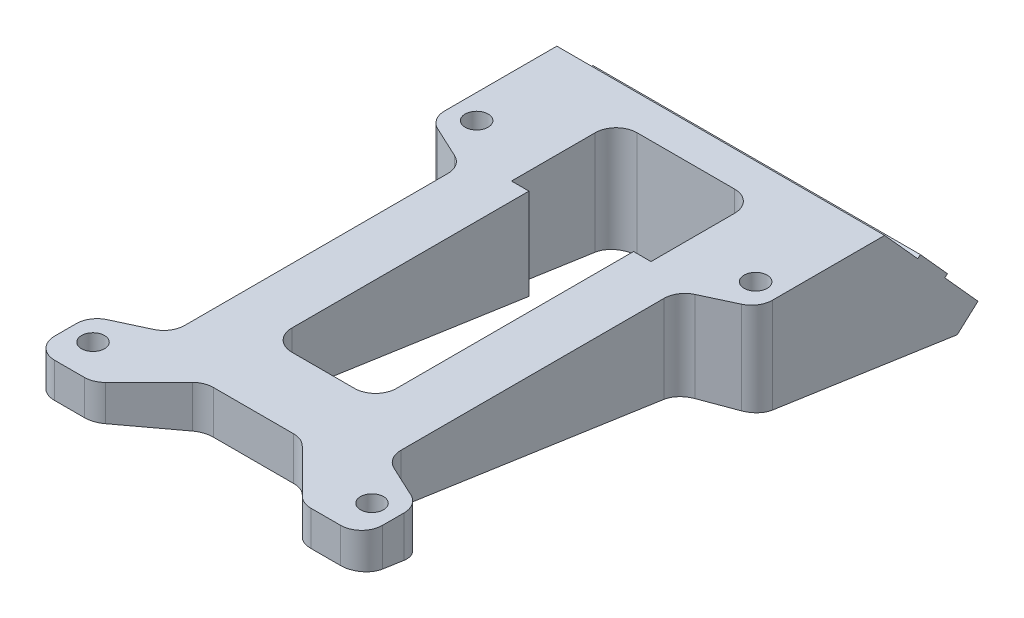
from build123d import *

# Parameters (mm, degrees)
EXTRUDE_2_DEPTH     = 5
SKETCH_3_R          = 1.65
CUT_EXTRUDE_1_DEPTH = 79.754364958
EXTRUDE_3_DEPTH     = 23.5
SKETCH_6_R          = 2.6
CUT_EXTRUDE_3_DEPTH = 83.719354566
CUT_EXTRUDE_4_REACH = 89.719
CUT_EXTRUDE_START   = -5
SKETCH_7_R          = 4.5
CUT_EXTRUDE_5_REACH = 85.529
CUT_EXTRUDE_START_2 = 3
SKETCH_8_R          = 3
CUT_EXTRUDE_2_DEPTH = 81.528760183
FILLET_1_R          = 3


with BuildPart() as part:
    # 草图2 → 凸台-拉伸2 (new body)
    with BuildSketch(Plane(origin=(0, 0, 0), x_dir=(1, 0, 0), z_dir=(0, 1, 0))):
        Polygon((0, 0), (23.5, 0), (23.5, -14), (23.5, -75), (0, -75), align=None)
    extrude_2 = extrude(amount=EXTRUDE_2_DEPTH)

    # 镜向1: 凸台-拉伸2 across plane
    add(extrude_2.mirror(Plane(origin=(0, 5, 75), x_dir=(0, 0, 1), z_dir=(1, 0, 0))))

    # 草图3 → 切除-拉伸1 (cut, through all)
    with BuildSketch(Plane(origin=(0, 5, 0), x_dir=(1, 0, 0), z_dir=(0, 1, 0))):
        with Locations(Location((-20, -15, 0), (0, 0, 270))):
            Circle(SKETCH_3_R)
        with Locations(Location((20, -15, 0), (0, 0, 270))):
            Circle(SKETCH_3_R)
        with Locations(Location((-20, -70, 0), (0, 0, 270))):
            Circle(SKETCH_3_R)
        with Locations(Location((20, -70, 0), (0, 0, 270))):
            Circle(SKETCH_3_R)
    extrude(amount=-CUT_EXTRUDE_1_DEPTH, mode=Mode.SUBTRACT)

    # 草图5 → 凸台-拉伸3 (add, symmetric)
    with BuildSketch(Plane(origin=(0, 0, 0), x_dir=(0, 0, -1), z_dir=(1, 0, 0))):
        Polygon((-75, 0), (10.410032825, -12.539418935), (13.382612127, -9.86289651), (0, 5), (0, 0), align=None)
        Polygon((4.750827305, -0.276328261), (8.631784822, -4.586568249), (9.003357235, -4.252002945), (5.122399718, 0.058237042), align=None)
    extrude(amount=EXTRUDE_3_DEPTH, both=True)

    # 草图6 → 切除-拉伸3 (cut, through all)
    with BuildSketch(Plane(origin=(0, 2.573244145, -2.857877151), x_dir=(1, 0, 0), z_dir=(0, 0.6691306063588544, -0.7431448254773979))):
        with Locations(Location((-13.5, 6.284275873, 0), (0, 0, 270))):
            Circle(SKETCH_6_R)
        with Locations(Location((13.5, 6.284275873, 0), (0, 0, 270))):
            Circle(SKETCH_6_R)
    extrude(amount=-CUT_EXTRUDE_3_DEPTH, mode=Mode.SUBTRACT)

    # 切除-拉伸4: up to this plane
    cut_extrude_4_end = Plane(origin=(23.5, -10.778746663, 1.582474746), z_dir=(0, 0.9893939239349117, -0.145257231423012))
    # 草图7 → 切除-拉伸4 (cut, up to the surface)
    with BuildSketch(Plane(origin=(0, 2.573244145, -2.857877151), x_dir=(1, 0, 0), z_dir=(0, 0.6691306063588544, -0.7431448254773979)).offset(CUT_EXTRUDE_START), mode=Mode.PRIVATE) as cut_extrude_4_sk1:
        with Locations(Location((-13.5, 6.284275873, 0), (0, 0, 270))):
            Circle(SKETCH_7_R)
    cut_extrude_4_tool1 = split(extrude(cut_extrude_4_sk1.sketch, amount=-CUT_EXTRUDE_4_REACH, mode=Mode.PRIVATE), bisect_by=cut_extrude_4_end, keep=Keep.BOTH, mode=Mode.PRIVATE)
    add(cut_extrude_4_tool1.solids().sort_by_distance((-13.5, -5.442536, -3.347154))[0], mode=Mode.SUBTRACT)
    # 草图7 → 切除-拉伸4 (cut, up to the surface)
    with BuildSketch(Plane(origin=(0, 2.573244145, -2.857877151), x_dir=(1, 0, 0), z_dir=(0, 0.6691306063588544, -0.7431448254773979)).offset(CUT_EXTRUDE_START), mode=Mode.PRIVATE) as cut_extrude_4_sk2:
        with Locations(Location((13.5, 6.284275873, 0), (0, 0, 270))):
            Circle(SKETCH_7_R)
    cut_extrude_4_tool2 = split(extrude(cut_extrude_4_sk2.sketch, amount=-CUT_EXTRUDE_4_REACH, mode=Mode.PRIVATE), bisect_by=cut_extrude_4_end, keep=Keep.BOTH, mode=Mode.PRIVATE)
    add(cut_extrude_4_tool2.solids().sort_by_distance((13.5, -5.442536, -3.347154))[0], mode=Mode.SUBTRACT)

    # 切除-拉伸5: up to this plane
    cut_extrude_5_end = Plane(origin=(23.5, -10.778746663, 1.582474746), z_dir=(0, 0.9893939239349117, -0.145257231423012))
    # 草图8 → 切除-拉伸5 (cut, up to the surface)
    with BuildSketch(Plane.XZ.offset(-5).offset(CUT_EXTRUDE_START_2), mode=Mode.PRIVATE) as cut_extrude_5_sk1:
        with Locations(Location((-20, 15, 0), (0, 0, 90))):
            Circle(SKETCH_8_R)
    cut_extrude_5_tool1 = split(extrude(cut_extrude_5_sk1.sketch, amount=CUT_EXTRUDE_5_REACH, mode=Mode.PRIVATE), bisect_by=cut_extrude_5_end, keep=Keep.BOTH, mode=Mode.PRIVATE)
    add(cut_extrude_5_tool1.solids().sort_by_distance((-20, 2, 15))[0], mode=Mode.SUBTRACT)
    # 草图8 → 切除-拉伸5 (cut, up to the surface)
    with BuildSketch(Plane.XZ.offset(-5).offset(CUT_EXTRUDE_START_2), mode=Mode.PRIVATE) as cut_extrude_5_sk2:
        with Locations(Location((20, 15, 0), (0, 0, 90))):
            Circle(SKETCH_8_R)
    cut_extrude_5_tool2 = split(extrude(cut_extrude_5_sk2.sketch, amount=CUT_EXTRUDE_5_REACH, mode=Mode.PRIVATE), bisect_by=cut_extrude_5_end, keep=Keep.BOTH, mode=Mode.PRIVATE)
    add(cut_extrude_5_tool2.solids().sort_by_distance((20, 2, 15))[0], mode=Mode.SUBTRACT)
    # 草图8 → 切除-拉伸5 (cut, up to the surface)
    with BuildSketch(Plane.XZ.offset(-5).offset(CUT_EXTRUDE_START_2), mode=Mode.PRIVATE) as cut_extrude_5_sk3:
        with Locations(Location((20, 70, 0), (0, 0, 90))):
            Circle(SKETCH_8_R)
    cut_extrude_5_tool3 = split(extrude(cut_extrude_5_sk3.sketch, amount=CUT_EXTRUDE_5_REACH, mode=Mode.PRIVATE), bisect_by=cut_extrude_5_end, keep=Keep.BOTH, mode=Mode.PRIVATE)
    add(cut_extrude_5_tool3.solids().sort_by_distance((20, 2, 70))[0], mode=Mode.SUBTRACT)
    # 草图8 → 切除-拉伸5 (cut, up to the surface)
    with BuildSketch(Plane.XZ.offset(-5).offset(CUT_EXTRUDE_START_2), mode=Mode.PRIVATE) as cut_extrude_5_sk4:
        with Locations(Location((-20, 70, 0), (0, 0, 90))):
            Circle(SKETCH_8_R)
    cut_extrude_5_tool4 = split(extrude(cut_extrude_5_sk4.sketch, amount=CUT_EXTRUDE_5_REACH, mode=Mode.PRIVATE), bisect_by=cut_extrude_5_end, keep=Keep.BOTH, mode=Mode.PRIVATE)
    add(cut_extrude_5_tool4.solids().sort_by_distance((-20, 2, 70))[0], mode=Mode.SUBTRACT)

    # 草图4 → 切除-拉伸2 (cut, through all)
    with BuildSketch(Plane(origin=(0, 5, 0), x_dir=(1, 0, 0), z_dir=(0, 1, 0))):
        Polygon((-10, -5), (-10, -20), (-7.5, -20), (-7.5, -57), (7.5, -57), (7.5, -20), (10, -20), (10, -5), align=None)
        Polygon((-7, -67), (-15, -75), (15, -75), (7, -67), align=None)
        Polygon((-23.5, -18), (-23.5, -67), (-15.5, -63.269538735), (-15.5, -21.730461265), align=None)
        Polygon((23.5, -18), (15.5, -21.730461265), (15.5, -63.269538735), (23.5, -67), align=None)
    extrude(amount=-CUT_EXTRUDE_2_DEPTH, mode=Mode.SUBTRACT)

    # 圆角1
    # the kernel refuses this fillet: 3 mm, written as the material it adds along each edge
    with BuildSketch(Plane(origin=(-15.5, 5, 21.730461265), x_dir=(-0.9063077870366472, 0, -0.42261826174070566), z_dir=(0, -1, 0))) as fillet_1_piece_1_section:
        with BuildLine():
            CenterArc((FILLET_1_R * 0.637070260807, -FILLET_1_R), FILLET_1_R, 90, 65)
            Line((-FILLET_1_R * 0.269237526229, -FILLET_1_R * 0.577381738259), (0, 0))
            Line((0, 0), (FILLET_1_R * 0.637070260807, 0))
        make_face()
    fillet_1_piece_1 = extrude(amount=17.598759961, mode=Mode.PRIVATE)
    fillet_1_piece_1 = split(fillet_1_piece_1, bisect_by=Plane(origin=(-15.879555916, -7.651082655, 22.886004601), z_dir=(0, 0.9893939239349115, -0.14525723142301197)), keep=Keep.TOP, mode=Mode.PRIVATE)
    add(fillet_1_piece_1)
    with BuildSketch(Plane(origin=(-15.5, 5, 63.269538735), x_dir=(0, 0, -1), z_dir=(0, -1, 0))) as fillet_1_piece_2_section:
        with BuildLine():
            CenterArc((FILLET_1_R * 0.637070260807, -FILLET_1_R), FILLET_1_R, 90, 65)
            Line((-FILLET_1_R * 0.269237526229, -FILLET_1_R * 0.577381738259), (0, 0))
            Line((0, 0), (FILLET_1_R * 0.637070260807, 0))
        make_face()
    fillet_1_piece_2 = extrude(amount=11.500227068, mode=Mode.PRIVATE)
    fillet_1_piece_2 = split(fillet_1_piece_2, bisect_by=Plane(origin=(-15.87363951, -1.687245158, 63.507628217), z_dir=(0, 0.9893939239349115, -0.14525723142301197)), keep=Keep.TOP, mode=Mode.PRIVATE)
    add(fillet_1_piece_2)
    with BuildSketch(Plane(origin=(7.5, 5, 57), x_dir=(0, 0, -1), z_dir=(0, -1, 0))) as fillet_1_piece_3_section:
        with BuildLine():
            CenterArc((FILLET_1_R, -FILLET_1_R), FILLET_1_R, 90, 90)
            Line((0, -FILLET_1_R), (0, 0))
            Line((0, 0), (FILLET_1_R, 0))
        make_face()
    fillet_1_piece_3 = extrude(amount=15.142658402, mode=Mode.PRIVATE)
    fillet_1_piece_3 = split(fillet_1_piece_3, bisect_by=Plane(origin=(6.825500476, -2.66184405, 56.869320354), z_dir=(0, 0.9893939239349115, -0.14525723142301197)), keep=Keep.TOP, mode=Mode.PRIVATE)
    add(fillet_1_piece_3)
    with BuildSketch(Plane(origin=(-7.5, 5, 57), x_dir=(1, 0, 0), z_dir=(0, -1, 0))) as fillet_1_piece_4_section:
        with BuildLine():
            CenterArc((FILLET_1_R, -FILLET_1_R), FILLET_1_R, 90, 90)
            Line((0, -FILLET_1_R), (0, 0))
            Line((0, 0), (FILLET_1_R, 0))
        make_face()
    fillet_1_piece_4 = extrude(amount=15.142658402, mode=Mode.PRIVATE)
    fillet_1_piece_4 = split(fillet_1_piece_4, bisect_by=Plane(origin=(-6.825500476, -2.66184405, 56.869320354), z_dir=(0, 0.9893939239349115, -0.14525723142301197)), keep=Keep.TOP, mode=Mode.PRIVATE)
    add(fillet_1_piece_4)
    with BuildSketch(Plane(origin=(-10, 5, 5), x_dir=(1, 0, 0), z_dir=(0, -1, 0))) as fillet_1_piece_5_section:
        with BuildLine():
            CenterArc((FILLET_1_R, FILLET_1_R), FILLET_1_R, 180, 90)
            Line((0, FILLET_1_R), (0, 0))
            Line((0, 0), (FILLET_1_R, 0))
        make_face()
    fillet_1_piece_5 = extrude(amount=21.652323405, mode=Mode.PRIVATE)
    fillet_1_piece_5 = split(fillet_1_piece_5, bisect_by=Plane(origin=(-9.315353327, -10.016611336, 6.773624645), z_dir=(0, 0.9893939239349115, -0.14525723142301197)), keep=Keep.TOP, mode=Mode.PRIVATE)
    fillet_1_piece_5 = fillet_1_piece_5 - Plane(origin=(-13.5, -8.634898015, 0.198322875), x_dir=(0, 0.7431448254773979, 0.6691306063588544), z_dir=(0, 0.6691306063588544, -0.7431448254773979)) * Cylinder(4.5, 56, mode=Mode.PRIVATE)
    add(fillet_1_piece_5)
    with BuildSketch(Plane(origin=(10, 5, 5), x_dir=(-1, 0, 0), z_dir=(0, -1, 0))) as fillet_1_piece_6_section:
        with BuildLine():
            CenterArc((FILLET_1_R, -FILLET_1_R), FILLET_1_R, 90, 90)
            Line((0, -FILLET_1_R), (0, 0))
            Line((0, 0), (FILLET_1_R, 0))
        make_face()
    fillet_1_piece_6 = extrude(amount=21.652323405, mode=Mode.PRIVATE)
    fillet_1_piece_6 = split(fillet_1_piece_6, bisect_by=Plane(origin=(9.315353327, -10.016611336, 6.773624643), z_dir=(0, 0.9893939239349115, -0.14525723142301197)), keep=Keep.TOP, mode=Mode.PRIVATE)
    fillet_1_piece_6 = fillet_1_piece_6 - Plane(origin=(13.5, -8.634898017, 0.198322878), x_dir=(0, 0.7431448254773979, 0.6691306063588544), z_dir=(0, 0.6691306063588544, -0.7431448254773979)) * Cylinder(4.5, 56, mode=Mode.PRIVATE)
    add(fillet_1_piece_6)
    with BuildSketch(Plane(origin=(7, 5, 67), x_dir=(-1, 0, 0), z_dir=(0, -1, 0))) as fillet_1_piece_7_section:
        with BuildLine():
            CenterArc((FILLET_1_R * 0.414213562373, -FILLET_1_R), FILLET_1_R, 90, 45)
            Line((-FILLET_1_R * 0.292893218813, -FILLET_1_R * 0.292893218813), (0, 0))
            Line((0, 0), (FILLET_1_R * 0.414213562373, 0))
        make_face()
    fillet_1_piece_7 = extrude(amount=9.281116563, mode=Mode.PRIVATE)
    fillet_1_piece_7 = split(fillet_1_piece_7, bisect_by=Plane(origin=(6.92099422, -1.082611782, 67.625981449), z_dir=(0, 0.9893939239349115, -0.14525723142301197)), keep=Keep.TOP, mode=Mode.PRIVATE)
    add(fillet_1_piece_7)
    with BuildSketch(Plane(origin=(-7, 5, 67), x_dir=(-0.7071067811865526, 0, 0.7071067811865426), z_dir=(0, -1, 0))) as fillet_1_piece_8_section:
        with BuildLine():
            CenterArc((FILLET_1_R * 0.414213562373, -FILLET_1_R), FILLET_1_R, 90, 45)
            Line((-FILLET_1_R * 0.292893218813, -FILLET_1_R * 0.292893218813), (0, 0))
            Line((0, 0), (FILLET_1_R * 0.414213562373, 0))
        make_face()
    fillet_1_piece_8 = extrude(amount=9.281116563, mode=Mode.PRIVATE)
    fillet_1_piece_8 = split(fillet_1_piece_8, bisect_by=Plane(origin=(-6.92099422, -1.082611782, 67.625981449), z_dir=(0, 0.9893939239349115, -0.14525723142301197)), keep=Keep.TOP, mode=Mode.PRIVATE)
    add(fillet_1_piece_8)
    with BuildSketch(Plane(origin=(15.5, 5, 63.269538735), x_dir=(0.9063077870366488, 0, 0.4226182617407019), z_dir=(0, -1, 0))) as fillet_1_piece_9_section:
        with BuildLine():
            CenterArc((FILLET_1_R * 0.637070260807, -FILLET_1_R), FILLET_1_R, 90, 65)
            Line((-FILLET_1_R * 0.269237526229, -FILLET_1_R * 0.577381738259), (0, 0))
            Line((0, 0), (FILLET_1_R * 0.637070260807, 0))
        make_face()
    fillet_1_piece_9 = extrude(amount=11.500227068, mode=Mode.PRIVATE)
    fillet_1_piece_9 = split(fillet_1_piece_9, bisect_by=Plane(origin=(15.87363951, -1.687245158, 63.507628217), z_dir=(0, 0.9893939239349115, -0.14525723142301197)), keep=Keep.TOP, mode=Mode.PRIVATE)
    add(fillet_1_piece_9)
    with BuildSketch(Plane(origin=(15.5, 5, 21.730461265), x_dir=(0.9063077870366475, 0, -0.4226182617407048), z_dir=(0, -1, 0))) as fillet_1_piece_10_section:
        with BuildLine():
            CenterArc((FILLET_1_R * 0.637070260807, FILLET_1_R), FILLET_1_R, 205, 65)
            Line((-FILLET_1_R * 0.269237526229, FILLET_1_R * 0.577381738259), (0, 0))
            Line((0, 0), (FILLET_1_R * 0.637070260807, 0))
        make_face()
    fillet_1_piece_10 = extrude(amount=17.598759961, mode=Mode.PRIVATE)
    fillet_1_piece_10 = split(fillet_1_piece_10, bisect_by=Plane(origin=(15.879555916, -7.651082655, 22.886004601), z_dir=(0, 0.9893939239349115, -0.14525723142301197)), keep=Keep.TOP, mode=Mode.PRIVATE)
    add(fillet_1_piece_10)
    # the kernel refuses this fillet: 3 mm, written as the material it takes off along each edge
    with BuildSketch(Plane(origin=(-23.5, 9.778026956, 67), x_dir=(0.9063077870366487, 0, -0.4226182617407022), z_dir=(0, -1, 0)), Plane(origin=(23.5, 9.778026956, 67), x_dir=(0, 0, 1), z_dir=(0, -1, 0))) as fillet_1_2_piece_1:
        with BuildLine():
            CenterArc((FILLET_1_R * 0.637070260807, FILLET_1_R), FILLET_1_R, 205, 65)
            Line((-FILLET_1_R * 0.269237526229, FILLET_1_R * 0.577381738259), (0, 0))
            Line((0, 0), (FILLET_1_R * 0.637070260807, 0))
        make_face()
    extrude(amount=15.730568757, mode=Mode.SUBTRACT)
    with BuildSketch(Plane(origin=(-23.5, 9.778026956, 18), x_dir=(0, 0, -1), z_dir=(0, -1, 0))) as fillet_1_2_piece_2:
        with BuildLine():
            CenterArc((FILLET_1_R * 0.637070260807, FILLET_1_R), FILLET_1_R, 205, 65)
            Line((-FILLET_1_R * 0.269237526229, FILLET_1_R * 0.577381738259), (0, 0))
            Line((0, 0), (FILLET_1_R * 0.637070260807, 0))
        make_face()
    extrude(amount=22.924472184, mode=Mode.SUBTRACT)
    with BuildSketch(Plane(origin=(15, 8.106601718, 75), x_dir=(-0.7071067811865526, 0, -0.7071067811865426), z_dir=(0, -1, 0)), Plane(origin=(-15, 8.106601718, 75), x_dir=(-1, 0, 0), z_dir=(0, -1, 0))) as fillet_1_2_piece_3:
        with BuildLine():
            CenterArc((FILLET_1_R * 0.414213562373, FILLET_1_R), FILLET_1_R, 225, 45)
            Line((-FILLET_1_R * 0.292893218813, FILLET_1_R * 0.292893218813), (0, 0))
            Line((0, 0), (FILLET_1_R * 0.414213562373, 0))
        make_face()
    extrude(amount=11.213203436, mode=Mode.SUBTRACT)
    with BuildSketch(Plane(origin=(-23.5, -7.5, 75), x_dir=(1, 0, 0), z_dir=(0, 1, 0))) as fillet_1_2_piece_4:
        with BuildLine():
            CenterArc((FILLET_1_R, FILLET_1_R), FILLET_1_R, 180, 90)
            Line((0, FILLET_1_R), (0, 0))
            Line((0, 0), (FILLET_1_R, 0))
        make_face()
    extrude(amount=20, mode=Mode.SUBTRACT)
    with BuildSketch(Plane(origin=(23.5, 9.778026956, 18), x_dir=(0, 0, -1), z_dir=(0, -1, 0))) as fillet_1_2_piece_5:
        with BuildLine():
            CenterArc((FILLET_1_R * 0.637070260807, -FILLET_1_R), FILLET_1_R, 90, 65)
            Line((-FILLET_1_R * 0.269237526229, -FILLET_1_R * 0.577381738259), (0, 0))
            Line((0, 0), (FILLET_1_R * 0.637070260807, 0))
        make_face()
    extrude(amount=22.924472184, mode=Mode.SUBTRACT)
    with BuildSketch(Plane(origin=(23.5, -7.5, 75), x_dir=(-1, 0, 0), z_dir=(0, 1, 0))) as fillet_1_2_piece_6:
        with BuildLine():
            CenterArc((FILLET_1_R, -FILLET_1_R), FILLET_1_R, 90, 90)
            Line((0, -FILLET_1_R), (0, 0))
            Line((0, 0), (FILLET_1_R, 0))
        make_face()
    extrude(amount=20, mode=Mode.SUBTRACT)


solid = part.part
